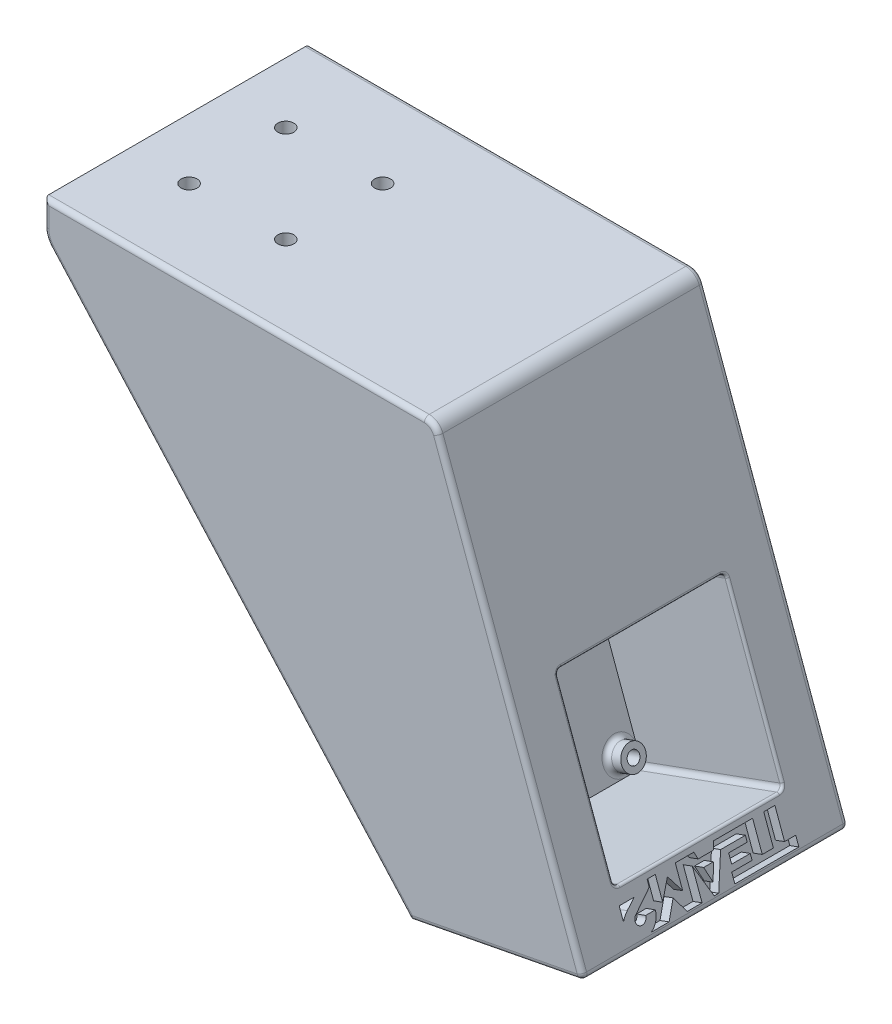
from build123d import *

# Parameters (mm, degrees)
SKETCH1_W                       = 45
SKETCH1_H                       = 45
SKETCH1_R                       = 1.65
BOSS_EXTRUDE1_DEPTH             = 7
SKETCH2_W                       = 45
SKETCH2_H                       = 45
SKETCH2_R                       = 1.25
BOSS_EXTRUDE2_DEPTH             = 5
SKETCH3_R                       = 2.5
SKETCH3_R_2                     = 1.25
BOSS_EXTRUDE3_DEPTH             = 3
BOSS_EXTRUDE3_2_DEPTH           = 3
BOSS_EXTRUDE3_3_DEPTH           = 3
BOSS_EXTRUDE3_4_DEPTH           = 3
SKETCH4_W                       = 45
SKETCH4_H                       = 45
SKETCH4_W_2                     = 35
SKETCH4_H_2                     = 35
BOSS_EXTRUDE4_DEPTH             = 31
CUT_EXTRUDE1_DEPTH              = 122.010748801
CUT_EXTRUDE1_DEPTH_BACK         = 5
SKETCH5_W                       = 13
SKETCH5_H                       = 7
BOSS_EXTRUDE5_REACH             = 130.375
BOSS_EXTRUDE5_DIRECTION_2_REACH = 130.375
BOSS_EXTRUDE6_DEPTH             = 4
BOSS_EXTRUDE7_REACH             = 136.16
CUT_EXTRUDE3_DEPTH              = 2
FILLET2_R                       = 1
FILLET3_R                       = 1
FILLET5_R                       = 0.5
BOSS_EXTRUDE8_DEPTH             = 5
FILLET6_R                       = 10
SKETCH13_R                      = 4.5
CUT_EXTRUDE4_DEPTH              = 2
FILLET7_START                   = -8.5
FILLET7_DEPTH                   = 16.9999999
FILLET7_START_2                 = -14.5
FILLET7_2_DEPTH                 = 42.5
FILLET7_3_ANGLE                 = 63.768371
FILLET7_4_ANGLE                 = 63.768371
FILLET8_R                       = 1


with BuildPart() as part:
    # Sketch1 → Boss-Extrude1 (new body)
    with BuildSketch(Plane(origin=(0, 0, 0), x_dir=(1, 0, 0), z_dir=(0, 1, 0))):
        Rectangle(SKETCH1_W, SKETCH1_H)
        with Locations(Location((-10, 10, 0), (0, 0, 270))):
            Circle(SKETCH1_R, mode=Mode.SUBTRACT)
        with Locations(Location((10, 10, 0), (0, 0, 270))):
            Circle(SKETCH1_R, mode=Mode.SUBTRACT)
        with Locations(Location((10, -10, 0), (0, 0, 270))):
            Circle(SKETCH1_R, mode=Mode.SUBTRACT)
        with Locations(Location((-10, -10, 0), (0, 0, 270))):
            Circle(SKETCH1_R, mode=Mode.SUBTRACT)
    extrude(amount=-BOSS_EXTRUDE1_DEPTH)


with BuildPart() as body_2:
    # Sketch2 → Boss-Extrude2 (new body)
    # profile 1 of 2: a face of its own
    with BuildSketch(Plane(origin=(17.618243351, 6.41251616, 0), x_dir=(0, 0, -1), z_dir=(0.939692620785907, 0.3420201433256726, 0))):
        with Locations((0, -81.77330157)):
            Rectangle(SKETCH2_W, SKETCH2_H)
        with Locations(Location((13.995, -95.76830157, 0), (0, 0, 90))):
            Circle(SKETCH2_R, mode=Mode.SUBTRACT)
        with Locations(Location((-13.995, -95.76830157, 0), (0, 0, 90))):
            Circle(SKETCH2_R, mode=Mode.SUBTRACT)
        with Locations(Location((13.995, -67.77830157, 0), (0, 0, 90))):
            Circle(SKETCH2_R, mode=Mode.SUBTRACT)
        with Locations(Location((-13.995, -67.77830157, 0), (0, 0, 90))):
            Circle(SKETCH2_R, mode=Mode.SUBTRACT)
    # profile 2 of 2: a face of its own
    with BuildSketch(Plane(origin=(17.618243351, 6.41251616, 0), x_dir=(0, 0, -1), z_dir=(0.939692620785907, 0.3420201433256726, 0))):
        with Locations((0, -36.77330157)):
            Rectangle(SKETCH2_W, SKETCH2_H)
    extrude(amount=BOSS_EXTRUDE2_DEPTH)



with BuildPart() as body_3:
    # Sketch3 → Boss-Extrude3 (new body)
    with BuildSketch(Plane(origin=(22.316706455, 8.122616877, 0), x_dir=(0, 0, -1), z_dir=(0.9396926207859071, 0.3420201433256727, 0))):
        with Locations(Location((13.995, -95.76830157, 0), (0, 0, 90))):
            Circle(SKETCH3_R)
        with Locations(Location((13.995, -95.76830157, 0), (0, 0, 90))):
            Circle(SKETCH3_R_2, mode=Mode.SUBTRACT)
    extrude(amount=BOSS_EXTRUDE3_DEPTH)


with BuildPart() as body_4:
    # Sketch3 → Boss-Extrude3 2 (new body)
    with BuildSketch(Plane(origin=(22.316706455, 8.122616877, 0), x_dir=(0, 0, -1), z_dir=(0.9396926207859071, 0.3420201433256727, 0))):
        with Locations(Location((-13.995, -95.76830157, 0), (0, 0, 90))):
            Circle(SKETCH3_R)
        with Locations(Location((-13.995, -95.76830157, 0), (0, 0, 90))):
            Circle(SKETCH3_R_2, mode=Mode.SUBTRACT)
    extrude(amount=BOSS_EXTRUDE3_2_DEPTH)


with BuildPart() as body_5:
    # Sketch3 → Boss-Extrude3 3 (new body)
    with BuildSketch(Plane(origin=(22.316706455, 8.122616877, 0), x_dir=(0, 0, -1), z_dir=(0.9396926207859071, 0.3420201433256727, 0))):
        with Locations(Location((-13.995, -67.77830157, 0), (0, 0, 90))):
            Circle(SKETCH3_R)
        with Locations(Location((-13.995, -67.77830157, 0), (0, 0, 90))):
            Circle(SKETCH3_R_2, mode=Mode.SUBTRACT)
    extrude(amount=BOSS_EXTRUDE3_3_DEPTH)


with BuildPart() as body_6:
    # Sketch3 → Boss-Extrude3 4 (new body)
    with BuildSketch(Plane(origin=(22.316706455, 8.122616877, 0), x_dir=(0, 0, -1), z_dir=(0.9396926207859071, 0.3420201433256727, 0))):
        with Locations(Location((13.995, -67.77830157, 0), (0, 0, 90))):
            Circle(SKETCH3_R)
        with Locations(Location((13.995, -67.77830157, 0), (0, 0, 90))):
            Circle(SKETCH3_R_2, mode=Mode.SUBTRACT)
    extrude(amount=BOSS_EXTRUDE3_4_DEPTH)


with BuildPart() as body_2_1:
    add(body_2.part)

    add(body_3.part)  # Boss-Extrude4 merges body 3

    add(body_4.part)  # Boss-Extrude4 merges body 4

    add(body_5.part)  # Boss-Extrude4 merges body 5

    add(body_6.part)  # Boss-Extrude4 merges body 6
    # Sketch4 → Boss-Extrude4 (add)
    with BuildSketch(Plane(origin=(22.316706455, 8.122616877, 0), x_dir=(0, 0, -1), z_dir=(0.9396926207859071, 0.3420201433256727, 0))):
        with Locations((0, -81.77330157)):
            Rectangle(SKETCH4_W, SKETCH4_H)
        with Locations((0, -81.77330157)):
            Rectangle(SKETCH4_W_2, SKETCH4_H_2, mode=Mode.SUBTRACT)
    extrude(amount=BOSS_EXTRUDE4_DEPTH)

    # Sketch5 → Cut-Extrude1 (cut, two sides: drawn at the far end of the back side and taken through both)
    with BuildSketch(Plane(origin=(22.316706455, 8.122616877, 0), x_dir=(0, 0, -1), z_dir=(0.9396926207859071, 0.3420201433256727, 0)).offset(-CUT_EXTRUDE1_DEPTH_BACK)):
        with Locations((-5.495, -68.77330157)):
            Rectangle(SKETCH5_W, SKETCH5_H)
    extrude(amount=CUT_EXTRUDE1_DEPTH + CUT_EXTRUDE1_DEPTH_BACK, mode=Mode.SUBTRACT)

    # Boss-Extrude5: up to this face of the body (flat: up to its plane)
    boss_extrude5_end = Plane(body_2_1.part.faces().sort_by_distance((58.847638791, -59.762541065, 22.5))[0])
    # Sketch6 → Boss-Extrude5 (add, up to the picked face)
    with BuildSketch(Plane.XY, mode=Mode.PRIVATE) as boss_extrude5_sk1:
        with BuildLine():
            Line((22.5, -7), (22.5, 0))
            Line((22.5, 0), (56.161985555, 0))
            ThreePointArc((56.161985555, 0), (57.882714864, -0.542543867), (58.981063417, -1.97393957))
            Line((58.981063417, -1.97393957), (71.719840798, -36.973442776))
            Line((71.719840798, -36.973442776), (42.589369554, -47.576067219))
            Line((42.589369554, -47.576067219), (27.198463104, -5.289899283))
            Line((27.198463104, -5.289899283), (22.5, -7))
        make_face()
    boss_extrude5_tool1 = split(extrude(boss_extrude5_sk1.sketch, amount=BOSS_EXTRUDE5_REACH, mode=Mode.PRIVATE), bisect_by=boss_extrude5_end, keep=Keep.BOTH, mode=Mode.PRIVATE)

    add(part.part)  # Boss-Extrude5 merges part
    add(boss_extrude5_tool1.solids().sort_by(Axis((48.396561, -20.96021, 0), (0, 0, 1)))[0])

    # Boss-Extrude5 direction 2: up to this face of the body (flat: up to its plane)
    boss_extrude5_direction_2_end = Plane(body_2_1.part.faces().sort_by_distance((58.847638791, -59.762541065, -22.5))[0])
    # Sketch6 → Boss-Extrude5 direction 2 (add, up to the picked face)
    with BuildSketch(Plane.XY, mode=Mode.PRIVATE) as boss_extrude5_direction_2_sk1:
        with BuildLine():
            Line((22.5, -7), (22.5, 0))
            Line((22.5, 0), (56.161985555, 0))
            ThreePointArc((56.161985555, 0), (57.882714864, -0.542543867), (58.981063417, -1.97393957))
            Line((58.981063417, -1.97393957), (71.719840798, -36.973442776))
            Line((71.719840798, -36.973442776), (42.589369554, -47.576067219))
            Line((42.589369554, -47.576067219), (27.198463104, -5.289899283))
            Line((27.198463104, -5.289899283), (22.5, -7))
        make_face()
    boss_extrude5_direction_2_tool1 = split(extrude(boss_extrude5_direction_2_sk1.sketch, amount=-BOSS_EXTRUDE5_DIRECTION_2_REACH, mode=Mode.PRIVATE), bisect_by=boss_extrude5_direction_2_end, keep=Keep.BOTH, mode=Mode.PRIVATE)
    add(boss_extrude5_direction_2_tool1.solids().sort_by(Axis((48.396561, -20.96021, 0), (0, 0, -1)))[0])

    # Sketch10 → Boss-Extrude6 (add)
    with BuildSketch(Plane.XY.offset(22.5)):
        Polygon((-22.5, -7), (22.5, -7), (53.281812899, -91.572335871), align=None)
    boss_extrude6 = extrude(amount=-BOSS_EXTRUDE6_DEPTH)

    # Mirror1: Boss-Extrude6 across plane
    add(boss_extrude6.mirror(Plane.XY))

    # Boss-Extrude7: up to this face of the body (flat: up to its plane)
    boss_extrude7_end = Plane(body_2_1.part.faces().sort_by_distance((38.496116171, -37.960441302, -22.5))[0])
    # Sketch11 → Boss-Extrude7 (add, up to the picked face)
    with BuildSketch(Plane.XY.offset(22.5), mode=Mode.PRIVATE) as boss_extrude7_sk1:
        Polygon((87.110747248, -79.259610711), (89.077363072, -84.662843281), (53.281812899, -91.572335871), align=None)
    boss_extrude7_tool1 = split(extrude(boss_extrude7_sk1.sketch, amount=-BOSS_EXTRUDE7_REACH, mode=Mode.PRIVATE), bisect_by=boss_extrude7_end, keep=Keep.BOTH, mode=Mode.PRIVATE)
    add(boss_extrude7_tool1.solids().sort_by(Axis((76.489974, -85.16493, 22.5), (0, 0, -1)))[0])

    # Sketch9 → Cut-Extrude3 (cut)
    # profile 1 of 2: a face of its own
    with BuildSketch(Plane(origin=(51.447177699, 18.72524132, 0), x_dir=(0, 0, -1), z_dir=(0.9396926207859067, 0.3420201433256737, 0))):
        with BuildLine():
            Line((17.5, -108.52330157), (17.5, -106.617165792))
            Line((17.5, -106.617165792), (15.195060715, -106.617165792))
            Line((15.195060715, -106.617165792), (15.195060715, -100.77330157))
            Line((15.195060715, -100.77330157), (12.89012143, -100.77330157))
            Line((12.89012143, -100.77330157), (12.89012143, -106.617165792))
            Line((12.89012143, -106.617165792), (10.585182145, -106.617165792))
            Line((10.585182145, -106.617165792), (10.585182145, -100.77330157))
            Line((10.585182145, -100.77330157), (2.508114851, -100.77330157))
            Line((2.508114851, -100.77330157), (2.047698184, -102.07330157))
            Line((2.047698184, -102.07330157), (-1.112498658, -102.07330157))
            Line((-1.112498658, -102.07330157), (-1.572915325, -100.77330157))
            Line((-1.572915325, -100.77330157), (-5.399939474, -100.77330157))
            Line((-5.399939474, -100.77330157), (-5.399939474, -105.257320126))
            Line((-5.399939474, -105.257320126), (-7.466912532, -102.07330157))
            Line((-7.466912532, -102.07330157), (-9.53388559, -105.257320126))
            Line((-9.53388559, -105.257320126), (-9.53388559, -100.77330157))
            Line((-9.53388559, -100.77330157), (-11.225135981, -100.77330157))
            Line((-11.225135981, -100.77330157), (-11.225135981, -102.07330157))
            Line((-11.225135981, -102.07330157), (-14.958183682, -104.84700816))
            ThreePointArc((-14.958183682, -104.84700816), (-14.797468685, -106.69901044), (-13.215045609, -105.723470095))
            Line((-13.215045609, -105.723470095), (-11.225135981, -105.723470095))
            ThreePointArc((-11.225135981, -105.723470095), (-11.712099919, -107.386100738), (-13.019099843, -108.52330157))
            Line((-13.019099843, -108.52330157), (-9.330708943, -108.52330157))
            Line((-9.330708943, -108.52330157), (-7.466912532, -105.490640419))
            Line((-7.466912532, -105.490640419), (-5.582381691, -108.52330157))
            Line((-5.582381691, -108.52330157), (-2.502672623, -108.52330157))
            Line((-2.502672623, -108.52330157), (-2.502672623, -102.607166084))
            Line((-2.502672623, -102.607166084), (0, -108.52330157))
            Line((0, -108.52330157), (0.935199526, -108.52330157))
            Line((0.935199526, -108.52330157), (3.353552847, -102.57220112))
            Line((3.353552847, -102.57220112), (8.484219103, -102.57220112))
            Line((8.484219103, -102.57220112), (8.484219103, -103.684895027))
            Line((8.484219103, -103.684895027), (4.63907159, -103.684895027))
            Line((4.63907159, -103.684895027), (4.63907159, -105.504471885))
            Line((4.63907159, -105.504471885), (8.484219103, -105.504471885))
            Line((8.484219103, -105.504471885), (8.484219103, -106.617165792))
            Line((8.484219103, -106.617165792), (4.265622011, -106.617165792))
            Line((4.265622011, -106.617165792), (4.265622011, -108.52330157))
            Line((4.265622011, -108.52330157), (17.5, -108.52330157))
        make_face()
        Polygon((1.472088478, -103.698552505), (-0.536888952, -103.698552505), (0.467599763, -106.534755937), align=None, mode=Mode.SUBTRACT)
    # profile 2 of 2: a face of its own
    with BuildSketch(Plane(origin=(51.447177699, 18.72524132, 0), x_dir=(0, 0, -1), z_dir=(0.9396926207859067, 0.3420201433256737, 0))):
        with BuildLine():
            Line((-17.5, -102.254077404), (-14.425298873, -102.254077404))
            Line((-14.425298873, -102.254077404), (-16.287199337, -103.584006307))
            ThreePointArc((-16.287199337, -103.584006307), (-16.953196914, -104.161061388), (-17.5, -104.852112563))
            Line((-17.5, -104.852112563), (-17.5, -102.254077404))
        make_face()
    extrude(amount=-CUT_EXTRUDE3_DEPTH, mode=Mode.SUBTRACT)

    # Fillet2
    fillet2_edges = [body_2_1.edges().sort_by_distance(p)[0] for p in [
        (70.835410909, -79.862459829, 17.5),
        (70.835410909, -79.862459829, -17.5),
        (58.864705892, -46.973218101, -17.5),
        (58.864705892, -46.973218101, 17.5),
    ]]
    fillet(fillet2_edges, radius=FILLET2_R)

    # Fillet3
    fillet3_edges = [body_2_1.edges().sort_by_distance(p)[0] for p in [
        (45.498250873, -55.568152959, 16.495),
        (55.926445043, -84.219380966, -13.995),
        (55.926445043, -84.219380966, 13.995),
        (46.353301231, -57.91738451, -13.995),
    ]]
    fillet(fillet3_edges, radius=FILLET3_R)

    # Fillet5
    fillet5_edges = [body_2_1.edges().sort_by_distance(p)[0] for p in [
        (85.400646531, -74.561147607, 0),
        (79.415294023, -58.116526743, -17.5),
        (79.415294023, -58.116526743, 17.5),
        (73.429941515, -41.67190588, 0),
        (85.30047115, -74.285918011, -17.207106781),
        (85.30047115, -74.285918011, 17.207106781),
        (73.530116895, -41.947135476, -17.207106781),
        (73.530116895, -41.947135476, 17.207106781),
    ]]
    fillet(fillet5_edges, radius=FILLET5_R)

    # Sketch12 → Boss-Extrude8 (add)
    with BuildSketch(Plane.XY.offset(22.5)):
        with BuildLine():
            Line((-22.5, 0), (-22.5, -7))
            Line((-22.5, -7), (53.281812899, -91.572335871))
            Line((53.281812899, -91.572335871), (89.077363072, -84.662843281))
            Line((89.077363072, -84.662843281), (58.981063417, -1.97393957))
            ThreePointArc((58.981063417, -1.97393957), (57.882714864, -0.542543867), (56.161985555, 0))
            Line((56.161985555, 0), (-22.5, 0))
        make_face()
    boss_extrude8 = extrude(amount=BOSS_EXTRUDE8_DEPTH)

    # Mirror2: Boss-Extrude8 across plane
    add(boss_extrude8.mirror(Plane.XY))

    # Fillet6
    # the kernel refuses this fillet: 10 mm, written as the material it adds along each edge
    with BuildSketch(Plane(origin=(-47.5, -7, -18.5), x_dir=(0, -1, 0), z_dir=(1, 0, 0))) as fillet6_piece_1_section:
        with BuildLine():
            CenterArc((FILLET6_R, -FILLET6_R), FILLET6_R, 90, 90)
            Line((0, -FILLET6_R), (0, 0))
            Line((0, 0), (FILLET6_R, 0))
        make_face()
    fillet6_piece_1 = extrude(amount=95, mode=Mode.PRIVATE)
    fillet6_piece_1 = split(fillet6_piece_1, bisect_by=Plane(origin=(-33.633620462, 5.425095853, -18.5), z_dir=(0.7447517583109435, 0.6673416055460336, 0)), keep=Keep.TOP, mode=Mode.PRIVATE)
    fillet6_piece_1 = fillet6_piece_1 - Plane(origin=(-10, -7, -10), x_dir=(0, 0, 1), z_dir=(0, 1, 0)) * Cylinder(1.65, 230, mode=Mode.PRIVATE)
    fillet6_piece_1 = fillet6_piece_1 - Plane(origin=(10, -7, -10), x_dir=(0, 0, 1), z_dir=(0, 1, 0)) * Cylinder(1.65, 230, mode=Mode.PRIVATE)
    add(fillet6_piece_1)
    with BuildSketch(Plane(origin=(22.5, -7, 18.5), x_dir=(0.34202014332567127, -0.9396926207859075, 0), z_dir=(0, 0, -1))) as fillet6_piece_2_section:
        with BuildLine():
            CenterArc((FILLET6_R * 0.70020753821, FILLET6_R), FILLET6_R, 200, 70)
            Line((-FILLET6_R * 0.239485082576, FILLET6_R * 0.657979856674), (0, 0))
            Line((0, 0), (FILLET6_R * 0.70020753821, 0))
        make_face()
    fillet6_piece_2 = extrude(amount=54.505188455, mode=Mode.PRIVATE)
    fillet6_piece_2 = split(fillet6_piece_2, bisect_by=Plane(origin=(22.5, -7, -27.5), z_dir=(0, 0, 1)), keep=Keep.TOP, mode=Mode.PRIVATE)
    add(fillet6_piece_2)
    with BuildSketch(Plane(origin=(-47.5, -7, 18.5), x_dir=(0, -1, 0), z_dir=(1, 0, 0))) as fillet6_piece_3_section:
        with BuildLine():
            CenterArc((FILLET6_R, FILLET6_R), FILLET6_R, 180, 90)
            Line((0, FILLET6_R), (0, 0))
            Line((0, 0), (FILLET6_R, 0))
        make_face()
    fillet6_piece_3 = extrude(amount=95, mode=Mode.PRIVATE)
    fillet6_piece_3 = split(fillet6_piece_3, bisect_by=Plane(origin=(-33.633620462, 5.425095853, 18.5), z_dir=(0.7447517583109435, 0.6673416055460336, 0)), keep=Keep.TOP, mode=Mode.PRIVATE)
    fillet6_piece_3 = fillet6_piece_3 - Plane(origin=(-10, -7, 10), x_dir=(0, 0, 1), z_dir=(0, 1, 0)) * Cylinder(1.65, 230, mode=Mode.PRIVATE)
    fillet6_piece_3 = fillet6_piece_3 - Plane(origin=(10, -7, 10), x_dir=(0, 0, 1), z_dir=(0, 1, 0)) * Cylinder(1.65, 230, mode=Mode.PRIVATE)
    add(fillet6_piece_3)

    # Sketch13 → Cut-Extrude4 (cut)
    with BuildSketch(Plane.XZ.offset(7)):
        with Locations((10, 10)):
            Circle(SKETCH13_R)
        with Locations((10, -10)):
            Circle(SKETCH13_R)
        with Locations((-10, -10)):
            Circle(SKETCH13_R)
        with Locations((-10, 10)):
            Circle(SKETCH13_R)
    extrude(amount=CUT_EXTRUDE4_DEPTH, mode=Mode.SUBTRACT)

    # Fillet7: read off the stored shape, not the designer's step
    # Fillet7 outline → Fillet7 (cut)
    with BuildSketch(Plane.XY.offset(FILLET7_START)):
        with BuildLine():
            Line((-22.5, -2), (-22.5, -7))
            Line((-22.5, -7), (-17.5, -7))
            ThreePointArc((-17.5, -7), (-21.035533906, -5.535533906), (-22.5, -2))
        make_face()
    extrude(amount=FILLET7_DEPTH, mode=Mode.SUBTRACT)

    # Fillet7 2 outline → Fillet7 2 (cut)
    with BuildSketch(Plane.XY.offset(FILLET7_START_2)):
        with BuildLine():
            Line((-22.5, -5.087574343), (-22.5, -7))
            Line((-22.5, -7), (-21.223758792, -8.424282371))
            ThreePointArc((-21.223758792, -8.424282371), (-22.170053209, -6.873800258), (-22.5, -5.087574343))
        make_face()
    extrude(amount=FILLET7_2_DEPTH, mode=Mode.SUBTRACT)

    # Fillet7 3 outline → Fillet7 3 (revolve, cut)
    with BuildSketch(Plane(origin=(0, -17, 8.5), x_dir=(0, 1, 0), z_dir=(0, 0, -1))):
        with BuildLine():
            Line((10, -22.5), (15, -22.5))
            ThreePointArc((15, -22.5), (11.464466094, -21.035533906), (10, -17.5))
            Line((10, -17.5), (10, -22.5))
        make_face()
    revolve(axis=Axis((0, -17, 8.5), (1, 0, 0)), revolution_arc=FILLET7_3_ANGLE, mode=Mode.SUBTRACT)

    # Fillet7 4 outline → Fillet7 4 (revolve, cut)
    with BuildSketch(Plane(origin=(0, -17, -8.5), x_dir=(0, 0.44200110399113013, -0.8970145060536213), z_dir=(0, -0.8970145060536213, -0.44200110399113013))):
        with BuildLine():
            Line((10, -22.5), (15, -22.5))
            ThreePointArc((15, -22.5), (11.464466094, -21.035533906), (10, -17.5))
            Line((10, -17.5), (10, -22.5))
        make_face()
    revolve(axis=Axis((0, -17, -8.5), (1, 0, 0)), revolution_arc=FILLET7_4_ANGLE, mode=Mode.SUBTRACT)

    # Fillet8
    fillet8_edges = [body_2_1.edges().sort_by_distance(p)[0] for p in [
        (89.077363072, -84.662843281, 0),
        (16.830992777, 0, 27.5),
        (-22.5, -2.543787171, 27.5),
        (71.179587986, -88.117589576, 27.5),
        (74.029213244, -43.318391425, 27.5),
        (57.882714864, -0.542543867, 27.5),
        (16.830992777, 0, -27.5),
        (57.882714864, -0.542543867, -27.5),
        (74.029213244, -43.318391425, -27.5),
        (71.179587986, -88.117589576, -27.5),
        (15.39090645, -49.286167935, -27.5),
        (16.029027054, -49.998309121, 27.5),
        (-22.170053209, -6.873800258, 27.5),
    ]]
    fillet(fillet8_edges, radius=FILLET8_R)


solid = body_2_1.part
